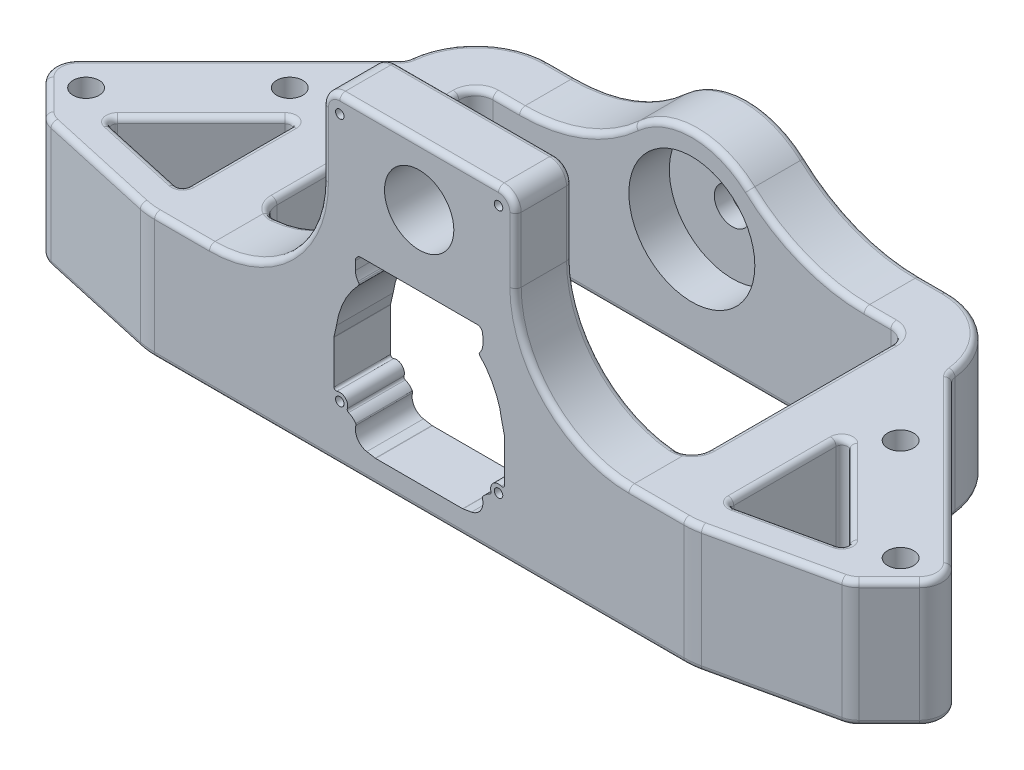
from build123d import *

# Parameters (mm, degrees)
SKETCH1_W           = 96.2
SKETCH1_H           = 58.1
SKETCH1_W_2         = 76.2
SKETCH1_H_2         = 38.1
SKETCH1_R           = 2.3
BOSS_EXTRUDE1_DEPTH = 22.25
BOSS_EXTRUDE2_START = 22.25
SKETCH1_3_W         = 96.2
SKETCH1_3_H         = 58.1
SKETCH1_3_W_2       = 76.2
SKETCH1_3_H_2       = 38.1
BOSS_EXTRUDE2_DEPTH = 15.85
SKETCH3_W           = 34
SKETCH3_H           = 18.6
SKETCH3_R           = 0.75
SKETCH3_R_2         = 6.113994518
BOSS_EXTRUDE3_DEPTH = 10
CUT_EXTRUDE1_REACH  = 115.883
SKETCH3_3_W         = 31.1
SKETCH3_3_H         = 15.85
CUT_EXTRUDE2_REACH  = 115.883
SKETCH3_4_R         = 0.75
CUT_EXTRUDE3_REACH  = 115.883
FILLET1_R           = 20
FILLET2_R           = 3
FILLET3_R           = 1
FILLET4_R           = 1
FILLET5_R           = 3
FILLET6_R           = 13
FILLET7_R           = 4
SKETCH5_R           = 11.1125
CUT_EXTRUDE4_DEPTH  = 7.1374
FILLET8_R           = 30
FILLET10_R          = 2
FILLET9_R           = 1


with BuildPart() as part:
    # Sketch1 → Boss-Extrude1 (new body)
    # profile 1 of 5: a face of its own
    with BuildSketch(Plane(origin=(0, 0, 0), x_dir=(1, 0, 0), z_dir=(0, 1, 0))):
        Rectangle(SKETCH1_W, SKETCH1_H)
        Rectangle(SKETCH1_W_2, SKETCH1_H_2, mode=Mode.SUBTRACT)
    # profile 2 of 5: a face of its own
    with BuildSketch(Plane(origin=(0, 0, 0), x_dir=(1, 0, 0), z_dir=(0, 1, 0))):
        Polygon((-70.887454814, -23.987710935), (-48.1, -29.05), (-48.1, -22.903727821), (-65.858399604, -18.958655725), align=None)
    # profile 3 of 5: a face of its own
    with BuildSketch(Plane(origin=(0, 0, 0), x_dir=(1, 0, 0), z_dir=(0, 1, 0))):
        Polygon((48.1, -22.903727821), (48.1, -29.05), (70.887454814, -23.987710935), (65.858399604, -18.958655725), align=None)
    # profile 4 of 5: a face of its own
    with BuildSketch(Plane(origin=(0, 0, 0), x_dir=(1, 0, 0), z_dir=(0, 1, 0))):
        Polygon((65.858399604, -18.958655725), (70.887454814, -23.987710935), (79.867710935, -15.007454814), (48.1, 16.760256121), (48.1, -1.200256121), align=None)
        with Locations(Location((71.842048969, -15.962048969, 0), (0, 0, 270))):
            Circle(SKETCH1_R, mode=Mode.SUBTRACT)
        with Locations(Location((53.881536726, 1.998463274, 0), (0, 0, 270))):
            Circle(SKETCH1_R, mode=Mode.SUBTRACT)
    # profile 5 of 5: a face of its own
    with BuildSketch(Plane(origin=(0, 0, 0), x_dir=(1, 0, 0), z_dir=(0, 1, 0))):
        Polygon((-79.867710935, -15.007454814), (-70.887454814, -23.987710935), (-65.858399604, -18.958655725), (-48.1, -1.200256121), (-48.1, 16.760256121), align=None)
        with Locations(Location((-71.842048969, -15.962048969, 0), (0, 0, 270))):
            Circle(SKETCH1_R, mode=Mode.SUBTRACT)
        with Locations(Location((-53.881536726, 1.998463274, 0), (0, 0, 270))):
            Circle(SKETCH1_R, mode=Mode.SUBTRACT)
    extrude(amount=BOSS_EXTRUDE1_DEPTH)

    # Sketch1<3> → Boss-Extrude2 (add)
    with BuildSketch(Plane(origin=(0, 0, 0), x_dir=(1, 0, 0), z_dir=(0, 1, 0)).offset(BOSS_EXTRUDE2_START)):
        Rectangle(SKETCH1_3_W, SKETCH1_3_H)
        Rectangle(SKETCH1_3_W_2, SKETCH1_3_H_2, mode=Mode.SUBTRACT)
    extrude(amount=BOSS_EXTRUDE2_DEPTH)

    # Sketch3 → Boss-Extrude3 (add)
    with BuildSketch(Plane.XY.offset(29.05)):
        with Locations((0, 47.4)):
            Rectangle(SKETCH3_W, SKETCH3_H)
        with Locations((-14, 53.7)):
            Circle(SKETCH3_R, mode=Mode.SUBTRACT)
        with Locations((0, 46.05)):
            Circle(SKETCH3_R_2, mode=Mode.SUBTRACT)
        with Locations((14, 53.7)):
            Circle(SKETCH3_R, mode=Mode.SUBTRACT)
    extrude(amount=-BOSS_EXTRUDE3_DEPTH)

    # Sketch3<3> → Cut-Extrude1 (cut, up to next)
    with BuildSketch(Plane.XY.offset(29.05), mode=Mode.PRIVATE) as cut_extrude1_sk1:
        with Locations((-32.55, 30.175)):
            Rectangle(SKETCH3_3_W, SKETCH3_3_H)
    cut_extrude1_tool1 = extrude(cut_extrude1_sk1.sketch, amount=-CUT_EXTRUDE1_REACH, mode=Mode.PRIVATE) & part.part
    # Sketch3<3> → Cut-Extrude1 (cut, up to next)
    with BuildSketch(Plane.XY.offset(29.05), mode=Mode.PRIVATE) as cut_extrude1_sk2:
        with Locations((32.55, 30.175)):
            Rectangle(SKETCH3_3_W, SKETCH3_3_H)
    cut_extrude1_tool2 = extrude(cut_extrude1_sk2.sketch, amount=-CUT_EXTRUDE1_REACH, mode=Mode.PRIVATE) & part.part
    add(cut_extrude1_tool1.solids().sort_by_distance((-32.55, 30.175, 29.05))[0], mode=Mode.SUBTRACT)
    add(cut_extrude1_tool2.solids().sort_by_distance((32.55, 30.175, 29.05))[0], mode=Mode.SUBTRACT)

    # Sketch3<4> → Cut-Extrude2 (cut, up to next)
    with BuildSketch(Plane.XY.offset(29.05), mode=Mode.PRIVATE) as cut_extrude2_sk1:
        with BuildLine():
            Line((-7.677283888, 4.25512505), (0, 4.25512505))
            Line((0, 4.25512505), (0, 33.677419885))
            ThreePointArc((0, 33.677419885), (-3.224781029, 33.317522554), (-6.29087514, 32.255540598))
            add(Edge.make_bspline(
                [(-6.29087514, 32.255540598), (-6.354123344, 32.225410324), (-6.425940061, 32.218415461), (-6.561336137, 32.252753207), (-6.621409073, 32.293361112), (-6.662588328, 32.350039494)],
                knots=[0, 0, 0, 0, 0.000207192, 0.000207192, 0.000414384, 0.000414384, 0.000414384, 0.000414384], degree=3))
            Line((-6.662588328, 32.350039494), (-6.852954845, 32.612056525))
            ThreePointArc((-6.852954845, 32.612056525), (-9.566892781, 33.493868415), (-11.24419867, 31.185254916))
            ThreePointArc((-11.24419867, 31.185254916), (-11.125392284, 30.435140919), (-10.780602724, 29.758453306))
            Line((-10.780602724, 29.758453306), (-10.650014249, 29.57871369))
            add(Edge.make_bspline(
                [(-10.650014249, 29.57871369), (-10.608797348, 29.521983492), (-10.588802383, 29.452580884), (-10.597914493, 29.313081434), (-10.626954198, 29.246551285), (-10.675261528, 29.195722635)],
                knots=[0, 0, 0, 0, 0.000207381, 0.000207381, 0.000414763, 0.000414763, 0.000414763, 0.000414763], degree=3))
            ThreePointArc((-10.675261528, 29.195722635), (-13.260415941, 25.457672398), (-14.582722774, 21.10939141))
            Line((-14.582722774, 21.10939141), (-15.034823926, 19.130918405))
            ThreePointArc((-15.034823926, 19.130918405), (-15.042354252, 19.086649043), (-15.04487495, 19.041814589))
            Line((-15.04487495, 19.041814589), (-15.04487495, 11.477902311))
            add(Edge.make_bspline(
                [(-15.04487495, 11.477902311), (-15.04487495, 11.347556499), (-14.977913043, 11.221268418), (-14.764315845, 11.074786106), (-14.623061319, 11.057781693), (-14.501392579, 11.104544234)],
                knots=[0, 0, 0, 0, 0.000387965, 0.000387965, 0.00077593, 0.00077593, 0.00077593, 0.00077593], degree=3))
            ThreePointArc((-14.501392579, 11.104544234), (-13.035153586, 10.811089301), (-12.67342862, 9.360183504))
            add(Edge.make_bspline(
                [(-12.67342862, 9.360183504), (-12.705194241, 9.264372263), (-12.698958784, 9.158171677), (-12.615527042, 8.976534106), (-12.53920304, 8.902740582), (-12.445843703, 8.864362493)],
                knots=[0, 0, 0, 0, 0.000301952, 0.000301952, 0.000603904, 0.000603904, 0.000603904, 0.000603904], degree=3))
            ThreePointArc((-12.445843703, 8.864362493), (-11.739786176, 8.442159607), (-11.188695899, 7.831363394))
            add(Edge.make_bspline(
                [(-11.188695899, 7.831363394), (-11.14058364, 7.758747016), (-11.126397589, 7.666819684), (-11.150380907, 7.58307766)],
                knots=[0, 0, 0, 0, 0.000257617, 0.000257617, 0.000257617, 0.000257617], degree=3))
            ThreePointArc((-11.150380907, 7.58307766), (-10.875139467, 5.628075507), (-9.238295824, 4.524203161))
            Line((-9.238295824, 4.524203161), (-7.746740514, 4.261201717))
            ThreePointArc((-7.746740514, 4.261201717), (-7.712144857, 4.256647112), (-7.677283888, 4.25512505))
        make_face()
    cut_extrude2_tool1 = extrude(cut_extrude2_sk1.sketch, amount=-CUT_EXTRUDE2_REACH, mode=Mode.PRIVATE) & part.part
    # Sketch3<4> → Cut-Extrude2 (cut, up to next)
    with BuildSketch(Plane.XY.offset(29.05), mode=Mode.PRIVATE) as cut_extrude2_sk2:
        with BuildLine():
            Line((0, 33.677419885), (0, 4.25512505))
            Line((0, 4.25512505), (7.677283888, 4.25512505))
            ThreePointArc((7.677283888, 4.25512505), (7.712144857, 4.256647112), (7.746740514, 4.261201717))
            Line((7.746740514, 4.261201717), (9.238295824, 4.524203161))
            ThreePointArc((9.238295824, 4.524203161), (10.875139467, 5.628075507), (11.150380907, 7.58307766))
            add(Edge.make_bspline(
                [(11.150380907, 7.58307766), (11.126397587, 7.666819693), (11.140583645, 7.758747024), (11.188695899, 7.831363394)],
                knots=[0, 0, 0, 0, 0.000257617, 0.000257617, 0.000257617, 0.000257617], degree=3))
            ThreePointArc((11.188695899, 7.831363394), (11.739786176, 8.442159607), (12.445843703, 8.864362493))
            add(Edge.make_bspline(
                [(12.445843703, 8.864362493), (12.539203063, 8.902740591), (12.615665227, 8.976706684), (12.698999551, 9.15838897), (12.705194234, 9.264372286), (12.67342862, 9.360183504)],
                knots=[0, 0, 0, 0, 0.000301952, 0.000301952, 0.000603904, 0.000603904, 0.000603904, 0.000603904], degree=3))
            ThreePointArc((12.67342862, 9.360183504), (13.035153586, 10.811089301), (14.501392579, 11.104544234))
            add(Edge.make_bspline(
                [(14.501392579, 11.104544234), (14.623061366, 11.057781675), (14.76496564, 11.07497916), (14.978326365, 11.221805697), (15.04487495, 11.347556549), (15.04487495, 11.477902311)],
                knots=[0, 0, 0, 0, 0.000387965, 0.000387965, 0.00077593, 0.00077593, 0.00077593, 0.00077593], degree=3))
            Line((15.04487495, 11.477902311), (15.04487495, 19.041814589))
            ThreePointArc((15.04487495, 19.041814589), (15.042354252, 19.086649043), (15.034823926, 19.130918405))
            Line((15.034823926, 19.130918405), (14.582722774, 21.10939141))
            ThreePointArc((14.582722774, 21.10939141), (13.260415941, 25.457672398), (10.675261528, 29.195722635))
            add(Edge.make_bspline(
                [(10.675261528, 29.195722635), (10.626954205, 29.246551277), (10.598021636, 29.312728517), (10.588742494, 29.452216956), (10.608797342, 29.521983484), (10.650014249, 29.57871369)],
                knots=[0, 0, 0, 0, 0.000207381, 0.000207381, 0.000414763, 0.000414763, 0.000414763, 0.000414763], degree=3))
            Line((10.650014249, 29.57871369), (10.780602724, 29.758453306))
            ThreePointArc((10.780602724, 29.758453306), (11.125392284, 30.435140919), (11.24419867, 31.185254916))
            Line((11.24419867, 31.185254916), (11.242123633, 31.28560265))
            ThreePointArc((11.242123633, 31.28560265), (9.519004074, 33.508882885), (6.852954845, 32.612056525))
            Line((6.852954845, 32.612056525), (6.662588328, 32.350039494))
            add(Edge.make_bspline(
                [(6.662588328, 32.350039494), (6.621409079, 32.293361119), (6.561652549, 32.252917009), (6.426296286, 32.218422661), (6.354123353, 32.225410319), (6.29087514, 32.255540598)],
                knots=[0, 0, 0, 0, 0.000207192, 0.000207192, 0.000414384, 0.000414384, 0.000414384, 0.000414384], degree=3))
            ThreePointArc((6.29087514, 32.255540598), (3.224781029, 33.317522554), (0, 33.677419885))
        make_face()
    cut_extrude2_tool2 = extrude(cut_extrude2_sk2.sketch, amount=-CUT_EXTRUDE2_REACH, mode=Mode.PRIVATE) & part.part
    # Sketch3<4> → Cut-Extrude2 (cut, up to next)
    with BuildSketch(Plane.XY.offset(29.05), mode=Mode.PRIVATE) as cut_extrude2_sk3:
        with BuildLine():
            ThreePointArc((-6.29087514, 32.255540598), (-3.224781029, 33.317522554), (0, 33.677419885))
            Line((0, 33.677419885), (-11.24419867, 33.677419885))
            Line((-11.24419867, 33.677419885), (-11.24419867, 31.185254916))
            ThreePointArc((-11.24419867, 31.185254916), (-9.566892781, 33.493868415), (-6.852954845, 32.612056525))
            Line((-6.852954845, 32.612056525), (-6.662588328, 32.350039494))
            add(Edge.make_bspline(
                [(-6.29087514, 32.255540598), (-6.354123344, 32.225410324), (-6.425940061, 32.218415461), (-6.561336137, 32.252753207), (-6.621409073, 32.293361112), (-6.662588328, 32.350039494)],
                knots=[0, 0, 0, 0, 0.000207192, 0.000207192, 0.000414384, 0.000414384, 0.000414384, 0.000414384], degree=3))
        make_face()
    cut_extrude2_tool3 = extrude(cut_extrude2_sk3.sketch, amount=-CUT_EXTRUDE2_REACH, mode=Mode.PRIVATE) & part.part
    # Sketch3<4> → Cut-Extrude2 (cut, up to next)
    with BuildSketch(Plane.XY.offset(29.05), mode=Mode.PRIVATE) as cut_extrude2_sk4:
        with BuildLine():
            Line((11.192664519, 33.677419885), (0, 33.677419885))
            ThreePointArc((0, 33.677419885), (3.224781029, 33.317522554), (6.29087514, 32.255540598))
            add(Edge.make_bspline(
                [(6.662588328, 32.350039494), (6.621409079, 32.293361119), (6.561652549, 32.252917009), (6.426296286, 32.218422661), (6.354123353, 32.225410319), (6.29087514, 32.255540598)],
                knots=[0, 0, 0, 0, 0.000207192, 0.000207192, 0.000414384, 0.000414384, 0.000414384, 0.000414384], degree=3))
            Line((6.662588328, 32.350039494), (6.852954845, 32.612056525))
            ThreePointArc((6.852954845, 32.612056525), (9.519004074, 33.508882885), (11.242123633, 31.28560265))
            Line((11.242123633, 31.28560265), (11.192664519, 33.677419885))
        make_face()
    cut_extrude2_tool4 = extrude(cut_extrude2_sk4.sketch, amount=-CUT_EXTRUDE2_REACH, mode=Mode.PRIVATE) & part.part
    # Sketch3<4> → Cut-Extrude2 (cut, up to next)
    with BuildSketch(Plane.XY.offset(29.05), mode=Mode.PRIVATE) as cut_extrude2_sk5:
        with Locations((14, 9.8)):
            Circle(SKETCH3_4_R)
    cut_extrude2_tool5 = extrude(cut_extrude2_sk5.sketch, amount=-CUT_EXTRUDE2_REACH, mode=Mode.PRIVATE) & part.part
    # Sketch3<4> → Cut-Extrude2 (cut, up to next)
    with BuildSketch(Plane.XY.offset(29.05), mode=Mode.PRIVATE) as cut_extrude2_sk6:
        with Locations((-14, 9.8)):
            Circle(SKETCH3_4_R)
    cut_extrude2_tool6 = extrude(cut_extrude2_sk6.sketch, amount=-CUT_EXTRUDE2_REACH, mode=Mode.PRIVATE) & part.part
    add(cut_extrude2_tool1.solids().sort_by_distance((-6.658417, 18.623439, 29.05))[0], mode=Mode.SUBTRACT)
    add(cut_extrude2_tool2.solids().sort_by_distance((6.658414, 18.623445, 29.05))[0], mode=Mode.SUBTRACT)
    add(cut_extrude2_tool3.solids().sort_by_distance((-6.742029, 33.207755, 29.05))[0], mode=Mode.SUBTRACT)
    add(cut_extrude2_tool4.solids().sort_by_distance((6.692011, 33.21179, 29.05))[0], mode=Mode.SUBTRACT)
    add(cut_extrude2_tool5.solids().sort_by_distance((14, 9.8, 29.05))[0], mode=Mode.SUBTRACT)
    add(cut_extrude2_tool6.solids().sort_by_distance((-14, 9.8, 29.05))[0], mode=Mode.SUBTRACT)

    # Sketch4 → Cut-Extrude3 (cut, up to next)
    with BuildSketch(Plane(origin=(0, 0, -29.05), x_dir=(-1, 0, 0), z_dir=(0, 0, -1)), mode=Mode.PRIVATE) as cut_extrude3_sk1:
        with BuildLine():
            Line((-17, 22.25), (-14.654692081, 22.25))
            ThreePointArc((-14.654692081, 22.25), (-9.407443861, 30.733321446), (0, 34.05))
            Line((0, 34.05), (0, 38.1))
            Line((0, 38.1), (-17, 38.1))
            Line((-17, 38.1), (-17, 22.25))
        make_face()
    cut_extrude3_tool1 = extrude(cut_extrude3_sk1.sketch, amount=-CUT_EXTRUDE3_REACH, mode=Mode.PRIVATE) & part.part
    # Sketch4 → Cut-Extrude3 (cut, up to next)
    with BuildSketch(Plane(origin=(0, 0, -29.05), x_dir=(-1, 0, 0), z_dir=(0, 0, -1)), mode=Mode.PRIVATE) as cut_extrude3_sk2:
        with BuildLine():
            Line((0, 38.1), (0, 34.05))
            ThreePointArc((0, 34.05), (9.407443861, 30.733321446), (14.654692081, 22.25))
            Line((14.654692081, 22.25), (17, 22.25))
            Line((17, 22.25), (17, 38.1))
            Line((17, 38.1), (0, 38.1))
        make_face()
    cut_extrude3_tool2 = extrude(cut_extrude3_sk2.sketch, amount=-CUT_EXTRUDE3_REACH, mode=Mode.PRIVATE) & part.part
    # Sketch4 → Cut-Extrude3 (cut, up to next)
    with BuildSketch(Plane(origin=(0, 0, -29.05), x_dir=(-1, 0, 0), z_dir=(0, 0, -1)), mode=Mode.PRIVATE) as cut_extrude3_sk3:
        with BuildLine():
            ThreePointArc((0, 22.225), (-3.175, 19.05), (0, 15.875))
            Line((0, 15.875), (0, 22.225))
        make_face()
    cut_extrude3_tool3 = extrude(cut_extrude3_sk3.sketch, amount=-CUT_EXTRUDE3_REACH, mode=Mode.PRIVATE) & part.part
    # Sketch4 → Cut-Extrude3 (cut, up to next)
    with BuildSketch(Plane(origin=(0, 0, -29.05), x_dir=(-1, 0, 0), z_dir=(0, 0, -1)), mode=Mode.PRIVATE) as cut_extrude3_sk4:
        with BuildLine():
            Line((0, 22.225), (0, 15.875))
            ThreePointArc((0, 15.875), (2.24506403, 16.80493597), (3.175, 19.05))
            ThreePointArc((3.175, 19.05), (2.24506403, 21.29506403), (0, 22.225))
        make_face()
    cut_extrude3_tool4 = extrude(cut_extrude3_sk4.sketch, amount=-CUT_EXTRUDE3_REACH, mode=Mode.PRIVATE) & part.part
    # Sketch4 → Cut-Extrude3 (cut, up to next)
    with BuildSketch(Plane(origin=(0, 0, -29.05), x_dir=(-1, 0, 0), z_dir=(0, 0, -1)), mode=Mode.PRIVATE) as cut_extrude3_sk5:
        with BuildLine():
            ThreePointArc((0, 22.225), (-3.175, 19.05), (0, 15.875))
            Line((0, 15.875), (0, 22.225))
        make_face()
    cut_extrude3_tool5 = extrude(cut_extrude3_sk5.sketch, amount=-CUT_EXTRUDE3_REACH, mode=Mode.PRIVATE) & part.part
    # Sketch4 → Cut-Extrude3 (cut, up to next)
    with BuildSketch(Plane(origin=(0, 0, -29.05), x_dir=(-1, 0, 0), z_dir=(0, 0, -1)), mode=Mode.PRIVATE) as cut_extrude3_sk6:
        with BuildLine():
            Line((0, 22.225), (0, 15.875))
            ThreePointArc((0, 15.875), (2.24506403, 16.80493597), (3.175, 19.05))
            ThreePointArc((3.175, 19.05), (2.24506403, 21.29506403), (0, 22.225))
        make_face()
    cut_extrude3_tool6 = extrude(cut_extrude3_sk6.sketch, amount=-CUT_EXTRUDE3_REACH, mode=Mode.PRIVATE) & part.part
    add(cut_extrude3_tool1.solids().sort_by_distance((10.827646, 32.931651, -29.05))[0], mode=Mode.SUBTRACT)
    add(cut_extrude3_tool2.solids().sort_by_distance((-10.827646, 32.931651, -29.05))[0], mode=Mode.SUBTRACT)
    add(cut_extrude3_tool3.solids().sort_by_distance((1.347512, 19.05, -29.05))[0], mode=Mode.SUBTRACT)
    add(cut_extrude3_tool4.solids().sort_by_distance((-1.347512, 19.05, -29.05))[0], mode=Mode.SUBTRACT)
    add(cut_extrude3_tool5.solids().sort_by_distance((1.347512, 19.05, -29.05))[0], mode=Mode.SUBTRACT)
    add(cut_extrude3_tool6.solids().sort_by_distance((-1.347512, 19.05, -29.05))[0], mode=Mode.SUBTRACT)

    # Fillet1
    fillet1_edges = [part.edges().sort_by_distance(p)[0] for p in [
        (-17, 22.25, 24.05),
        (17, 22.25, 24.05),
    ]]
    fillet(fillet1_edges, radius=FILLET1_R)

    # Fillet2
    fillet2_edges = [part.edges().sort_by_distance(p)[0] for p in [
        (-17, 56.7, 24.05),
        (17, 56.7, 24.05),
    ]]
    fillet(fillet2_edges, radius=FILLET2_R)

    # Fillet3
    fillet3_edges = [part.edges().sort_by_distance(p)[0] for p in [
        (-11.24419867, 33.677419885, 24.05),
        (11.192664519, 33.677419885, 24.05),
    ]]
    fillet(fillet3_edges, radius=FILLET3_R)

    # Fillet4
    fillet4_edges = [part.edges().sort_by_distance(p)[0] for p in [
        (-48.1, 11.125, 22.903727821),
        (-48.1, 11.125, 1.200256121),
        (-65.858399604, 11.125, 18.958655725),
        (48.1, 11.125, 1.200256121),
        (48.1, 11.125, 22.903727821),
        (65.858399604, 11.125, 18.958655725),
    ]]
    fillet(fillet4_edges, radius=FILLET4_R)

    # Fillet5
    fillet5_edges = [part.edges().sort_by_distance(p)[0] for p in [
        (-38.1, 11.125, -19.05),
        (38.1, 11.125, -19.05),
        (38.1, 11.125, 19.05),
        (-38.1, 11.125, 19.05),
    ]]
    fillet(fillet5_edges, radius=FILLET5_R)

    # Fillet6
    # the kernel refuses this fillet: 13 mm, written as the material it takes off along each edge
    with BuildSketch(Plane(origin=(48.1, 54.701457618, -29.05), x_dir=(0, 0, 1), z_dir=(0, -1, 0))) as fillet6_piece_1:
        with BuildLine():
            CenterArc((13, 12.980583047), FILLET6_R, 180, 86.8680807)
            Line((0, 12.980583047), (-0.26, 12.980583047))
            Line((-0.26, 12.980583047), (-0.26, 0))
            Line((-0.26, 0), (0, -0.26))
            ThreePointArc((0, -0.26), (6.144871939, -0.26), (12.275538757, -0.259611661))
            Line((12.275538757, -0.259611661), (12.289743879, 0))
        make_face()
    extrude(amount=87.152915235, mode=Mode.SUBTRACT)
    with BuildSketch(Plane(origin=(-48.1, 54.701457618, -29.05), x_dir=(1, 0, 0), z_dir=(0, -1, 0))) as fillet6_piece_2:
        with BuildLine():
            CenterArc((12.980583047, 13), FILLET6_R, 183.1319193, 86.8680807)
            Line((0, 12.289743879), (-0.259611661, 12.275538757))
            ThreePointArc((-0.259611661, 12.275538757), (-0.26, 6.144871939), (-0.26, 0))
            Line((-0.26, 0), (0, -0.26))
            Line((0, -0.26), (12.980583047, -0.26))
            Line((12.980583047, -0.26), (12.980583047, 0))
        make_face()
    extrude(amount=87.152915235, mode=Mode.SUBTRACT)
    with BuildSketch(Plane(origin=(-48.1, -3.566504059, 29.05), x_dir=(1, 0, 0), z_dir=(0, 1, 0))) as fillet6_piece_3:
        with BuildLine():
            CenterArc((FILLET6_R * 0.109738586416, FILLET6_R), FILLET6_R, 257.47500152, 12.52499848)
            Line((-FILLET6_R * 0.10712697051, FILLET6_R * 0.0237985196593), (-FILLET6_R * 0.111464281648, FILLET6_R * 0.00427449005251))
            Line((-FILLET6_R * 0.111464281648, FILLET6_R * 0.00427449005251), (-FILLET6_R * 0.00219477172832, -FILLET6_R * 0.02))
            Line((-FILLET6_R * 0.00219477172832, -FILLET6_R * 0.02), (FILLET6_R * 0.109738586416, -FILLET6_R * 0.02))
            Line((FILLET6_R * 0.109738586416, -FILLET6_R * 0.02), (FILLET6_R * 0.109738586416, 0))
        make_face()
    extrude(amount=29.383008117, mode=Mode.SUBTRACT)
    with BuildSketch(Plane(origin=(48.1, -3.566504059, 29.05), x_dir=(-1, 0, 0), z_dir=(0, 1, 0))) as fillet6_piece_4:
        with BuildLine():
            CenterArc((FILLET6_R * 0.109738586416, -FILLET6_R), FILLET6_R, 90, 12.52499848)
            Line((-FILLET6_R * 0.10712697051, -FILLET6_R * 0.0237985196593), (-FILLET6_R * 0.111464281648, -FILLET6_R * 0.00427449005251))
            Line((-FILLET6_R * 0.111464281648, -FILLET6_R * 0.00427449005251), (-FILLET6_R * 0.00219477172832, FILLET6_R * 0.02))
            Line((-FILLET6_R * 0.00219477172832, FILLET6_R * 0.02), (FILLET6_R * 0.109738586416, FILLET6_R * 0.02))
            Line((FILLET6_R * 0.109738586416, FILLET6_R * 0.02), (FILLET6_R * 0.109738586416, 0))
        make_face()
    extrude(amount=29.383008117, mode=Mode.SUBTRACT)

    # Fillet7
    fillet7_edges = [part.edges().sort_by_distance(p)[0] for p in [
        (-70.887454814, 11.125, 23.987710935),
        (-79.867710935, 11.125, 15.007454814),
        (79.867710935, 11.125, 15.007454814),
        (70.887454814, 11.125, 23.987710935),
    ]]
    fillet(fillet7_edges, radius=FILLET7_R)

    # Sketch5 → Cut-Extrude4 (cut)
    with BuildSketch(Plane.XY.offset(-19.05)):
        with Locations((0, 19.05)):
            Circle(SKETCH5_R)
    extrude(amount=-CUT_EXTRUDE4_DEPTH, mode=Mode.SUBTRACT)

    # Fillet8
    fillet8_edges = [part.edges().sort_by_distance(p)[0] for p in [
        (-14.654692081, 22.25, -24.05),
        (14.654692081, 22.25, -24.05),
    ]]
    fillet(fillet8_edges, radius=FILLET8_R)

    # Fillet10
    fillet10_edges = [part.edges().sort_by_distance(p)[0] for p in [
        (-48.1, 11.125, -16.760256121),
        (48.1, 11.125, -16.760256121),
    ]]
    fillet(fillet10_edges, radius=FILLET10_R)

    # Fillet9
    fillet9_edges = [part.edges().sort_by_distance(p)[0] for p in [
        (41.836699188, 22.25, 29.05),
        (17, 47.975, 19.05),
        (-17, 47.975, 29.05),
        (22.857864376, 28.107864376, 29.05),
        (22.201351413, 28.796375953, 19.05),
        (-22.857864376, 28.107864376, 29.05),
        (0, 56.7, 19.05),
        (0, 56.7, 29.05),
        (17, 47.975, 29.05),
        (16.121320344, 55.821320344, 29.05),
        (-16.121320344, 55.821320344, 29.05),
        (-17, 47.975, 19.05),
        (16.121320344, 55.821320344, 19.05),
        (-16.121320344, 55.821320344, 19.05),
        (56.698402487, 0, 20.993571586),
        (56.698402487, 22.25, 20.993571586),
        (57.188643711, 0, 10.288899832),
        (57.188643711, 22.25, 10.288899832),
        (48.1, 22.25, 12.635833176),
        (48.1, 0, 12.635833176),
        (-48.1, 22.25, 12.635833176),
        (-48.1, 0, 12.635833176),
        (-57.188643711, 0, 10.288899832),
        (-57.188643711, 22.25, 10.288899832),
        (-56.698402487, 0, 20.993571586),
        (-56.698402487, 22.25, 20.993571586),
        (64.823184737, 0, 18.657163113),
        (64.823184737, 22.25, 18.657163113),
        (48.474246677, 0, 22.437217679),
        (48.474246677, 22.25, 22.437217679),
        (48.717316568, 0, 2.690590151),
        (48.717316568, 22.25, 2.690590151),
        (-48.717316568, 0, 2.690590151),
        (-48.717316568, 22.25, 2.690590151),
        (-48.474246677, 0, 22.437217679),
        (-48.474246677, 22.25, 22.437217679),
        (-64.823184737, 0, 18.657163113),
        (-64.823184737, 22.25, 18.657163113),
        (32.738482479, 22.25, -19.05),
        (0, 0, -19.05),
        (-38.1, 22.25, 0),
        (-38.1, 0, 0),
        (38.1, 22.25, 0),
        (38.1, 0, 0),
        (0, 0, 19.05),
        (-22.201351413, 28.796375953, 19.05),
        (-37.221320344, 0, -18.171320344),
        (-37.221320344, 22.25, -18.171320344),
        (37.221320344, 0, -18.171320344),
        (37.221320344, 22.25, -18.171320344),
        (37.221320344, 0, 18.171320344),
        (37.811088342, 22.25, 17.334523258),
        (36.10766428, 22.269916498, 18.875705742),
        (-37.221320344, 0, 18.171320344),
        (-36.10766428, 22.269916498, 18.875705742),
        (-37.811088342, 22.25, 17.334523258),
        (32.748190955, 22.25, -29.05),
        (0, 0, -29.05),
        (0, 0, 29.05),
        (-59.621441226, 0, 26.490483529),
        (59.621441226, 0, 26.490483529),
        (48.091486847, 0, 28.972423344),
        (-48.091486847, 0, 28.972423344),
        (43.805963731, 0, -25.721809814),
        (59.621441226, 22.25, 26.490483529),
        (48.091486847, 22.25, 28.972423344),
        (-41.836699188, 22.25, 29.05),
        (-59.621441226, 22.25, 26.490483529),
        (-48.091486847, 22.25, 28.972423344),
        (-43.805963731, 22.25, -25.721809814),
        (62.829163279, 0, -2.031092842),
        (62.829163279, 22.25, -2.031092842),
        (74.375240271, 0, 20.499925478),
        (-74.375240271, 0, 20.499925478),
        (-62.829163279, 0, -2.031092842),
        (-78.210856686, 0, 15.007454814),
        (-70.807489679, 0, 23.842029115),
        (70.807489679, 0, 23.842029115),
        (78.210856686, 0, 15.007454814),
        (74.375240271, 22.25, 20.499925478),
        (70.807489679, 22.25, 23.842029115),
        (78.210856686, 22.25, 15.007454814),
        (-74.375240271, 22.25, 20.499925478),
        (-62.829163279, 22.25, -2.031092842),
        (-78.210856686, 22.25, 15.007454814),
        (-70.807489679, 22.25, 23.842029115),
        (0, 34.05, -19.05),
        (0, 34.05, -29.05),
        (-32.738482479, 22.25, -19.05),
        (-32.748190955, 22.25, -29.05),
        (19.514184466, 24.285737092, -29.05),
        (19.514184466, 24.285737092, -19.05),
        (-19.514184466, 24.285737092, -29.05),
        (-19.514184466, 24.285737092, -19.05),
        (-43.805963731, 0, -25.721809814),
        (43.805963731, 22.25, -25.721809814),
        (-48.229169517, 0, -16.79213623),
        (-48.229169517, 22.25, -16.79213623),
        (48.229169517, 0, -16.79213623),
        (48.229169517, 22.25, -16.79213623),
    ]]
    fillet(fillet9_edges, radius=FILLET9_R)


solid = part.part
